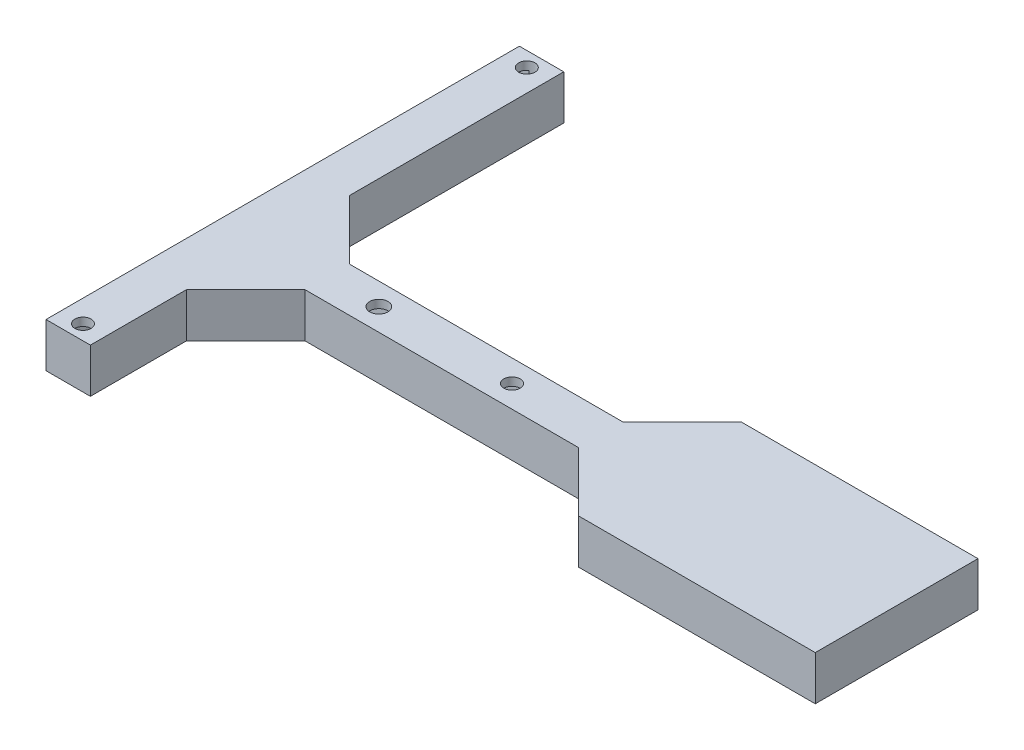
from build123d import *

# Parameters (mm, degrees)
BOSS_EXTRUDE1_DEPTH = 15
SHELL1_T            = -2.75
SKETCH2_R           = 2.75
SKETCH2_R_2         = 3.071803615
CUT_EXTRUDE1_DEPTH  = 10
CHAMFER1_SIZE       = 20


with BuildPart() as part:
    # Sketch1 → Boss-Extrude1 (new body)
    with BuildSketch(Plane(origin=(0, 0, 0), x_dir=(1, 0, 0), z_dir=(0, 1, 0))):
        Polygon((-227.5, 100), (-212.5, 100), (-212.5, 7.5), (-80, 7.5), (-80, 27.5), (0, 27.5), (0, 7.5), (0, -7.5), (0, -27.5), (-80, -27.5), (-80, -7.5), (-212.5, -7.5), (-212.5, -60), (-227.5, -60), align=None)
    extrude(amount=BOSS_EXTRUDE1_DEPTH)

    # Shell1
    shell1_openings = [part.faces().sort_by_distance(p)[0] for p in [
        (-113.191678521, 0, -5.46230441),
    ]]
    offset(amount=SHELL1_T, openings=shell1_openings, kind=Kind.INTERSECTION)

    # Sketch2 → Cut-Extrude1 (cut)
    with BuildSketch(Plane(origin=(0, 15, 0), x_dir=(1, 0, 0), z_dir=(0, 1, 0))):
        with Locations(Location((-130, 0, 0), (0, 0, 270))):
            Circle(SKETCH2_R)
        with Locations(Location((-220, 95, 0), (0, 0, 270))):
            Circle(SKETCH2_R)
        with Locations(Location((-220, -55, 0), (0, 0, 270))):
            Circle(SKETCH2_R)
        with Locations(Location((-175, 0, 0), (0, 0, 270))):
            Circle(SKETCH2_R_2)
    extrude(amount=-CUT_EXTRUDE1_DEPTH, mode=Mode.SUBTRACT)

    # Chamfer1
    chamfer1_edges = [part.edges().sort_by_distance(p)[0] for p in [
        (-212.5, 7.5, -7.5),
        (-212.5, 7.5, 7.5),
        (-80, 7.5, -7.5),
        (-80, 7.5, 7.5),
    ]]
    chamfer(chamfer1_edges, length=CHAMFER1_SIZE - 0.0001)  # a hair under: the kernel refuses the full size


solid = part.part
